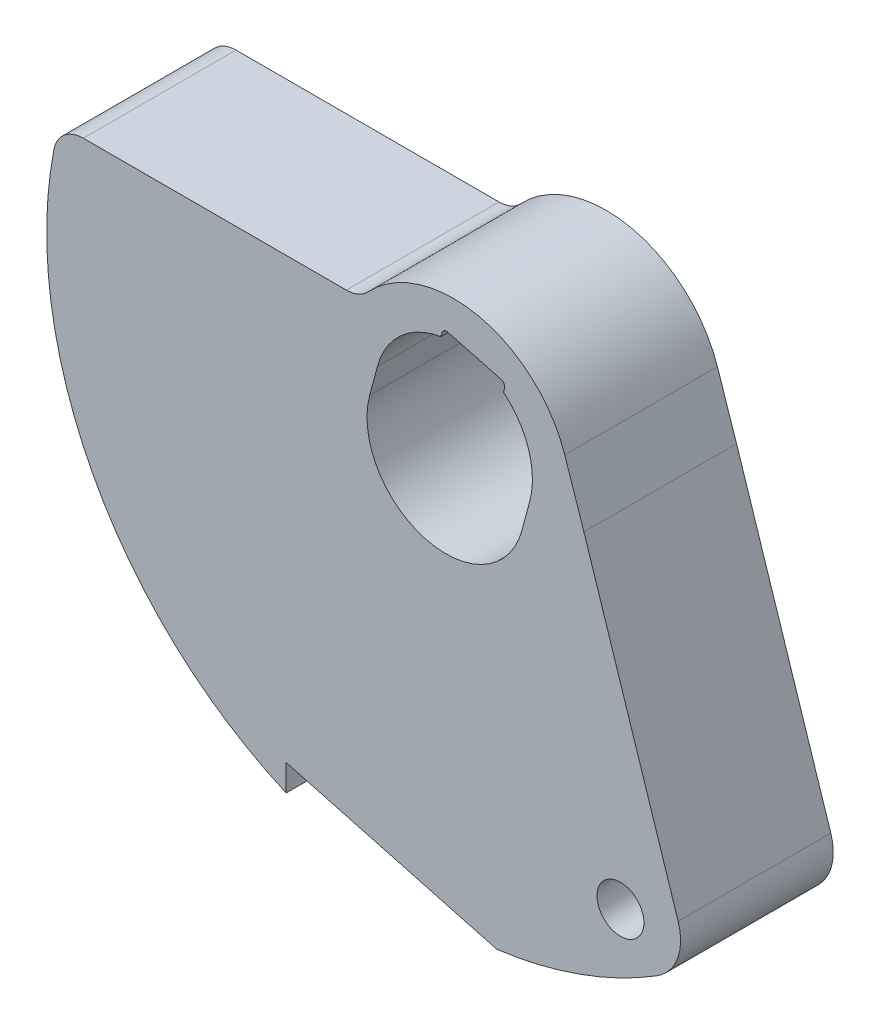
from build123d import *

# Parameters (mm, degrees)
SKETCH1_R               = 1.1938
BOSS_EXTRUDE1_DEPTH     = 7.7724
CUT_EXTRUDE1_DEPTH      = 30.656212081
CUT_EXTRUDE1_DEPTH_BACK = 30.656212081
FILLET1_R               = 2.54


with BuildPart() as part:
    # Sketch1 → Boss-Extrude1 (new body)
    with BuildSketch(Plane.XY):
        with BuildLine():
            ThreePointArc((-3.95481445, 5.560217822), (-4.460344292, 5.205196933), (-5.065262452, 5.08))
            Line((-5.065262452, 5.08), (-18.456556559, 5.08))
            ThreePointArc((-18.456556559, 5.08), (-19.426909517, 4.731155792), (-19.953034117, 3.844324324))
            ThreePointArc((-19.953034117, 3.844324324), (-17.981598542, -9.463853015), (-8.128, -18.623587624))
            Line((-8.128, -18.623587624), (-8.128, -17.281160051))
            Line((-8.128, -17.281160051), (2.593084415, -20.153865962))
            ThreePointArc((2.593084415, -20.153865962), (10.900004065, -17.149119843), (17.146958643, -10.903403565))
            Line((17.146958643, -10.903403565), (12.940315476, -3.61728387))
            ThreePointArc((12.940315476, -3.61728387), (12.796393961, -3.475289825), (12.60008731, -3.426922378))
            ThreePointArc((12.60008731, -3.426922378), (9.17217903, -2.398369889), (7.028137334, 0.467212181))
            Line((7.028137334, 0.467212181), (6.053096787, 3.371693793))
            ThreePointArc((6.053096787, 3.371693793), (1.669604011, 7.303273092), (-3.95481445, 5.560217822))
        make_face()
        with Locations((8.89, -15.24)):
            Circle(SKETCH1_R, mode=Mode.SUBTRACT)
        with BuildLine():
            ThreePointArc((3.876453526, -1.038692592), (-1.038692592, -3.876453526), (-3.876453526, 1.038692592))
            Line((-3.876453526, 1.038692592), (-3.482013301, 2.510763551))
            ThreePointArc((-3.482013301, 2.510763551), (-2.298514325, 4.447599489), (-0.253578298, 5.432607064))
            Line((-0.253578298, 5.432607064), (-0.201054745, 5.628627633))
            ThreePointArc((-0.201054745, 5.628627633), (-0.082709585, 5.782858048), (0.110030452, 5.808232755))
            Line((0.110030452, 5.808232755), (2.808827211, 5.085092343))
            ThreePointArc((2.808827211, 5.085092343), (2.963057626, 4.966747183), (2.988432333, 4.774007146))
            Line((2.988432333, 4.774007146), (2.93590878, 4.577986577))
            ThreePointArc((2.93590878, 4.577986577), (4.214371541, 2.702476981), (4.270893751, 0.433378367))
            Line((4.270893751, 0.433378367), (3.876453526, -1.038692592))
        make_face(mode=Mode.SUBTRACT)
    extrude(amount=-BOSS_EXTRUDE1_DEPTH)

    # Sketch2 → Cut-Extrude1 (cut, two sides: drawn at the far end of the back side and taken through both)
    with BuildSketch(Plane.XY.offset(-CUT_EXTRUDE1_DEPTH_BACK)):
        Polygon((-20.975210343, 86.652654313), (7.028137334, 0.467212181), (12.408372181, -16.091448034), (40.411719858, -102.276890166), (212.782604123, -46.270194811), (151.395673921, 142.659349668), align=None)
    extrude(amount=CUT_EXTRUDE1_DEPTH + CUT_EXTRUDE1_DEPTH_BACK, mode=Mode.SUBTRACT)

    # Fillet1
    fillet1_edges = [part.edges().sort_by_distance(p)[0] for p in [
        (12.408372181, -16.091448034, -3.8862),
    ]]
    fillet(fillet1_edges, radius=FILLET1_R)


solid = part.part
